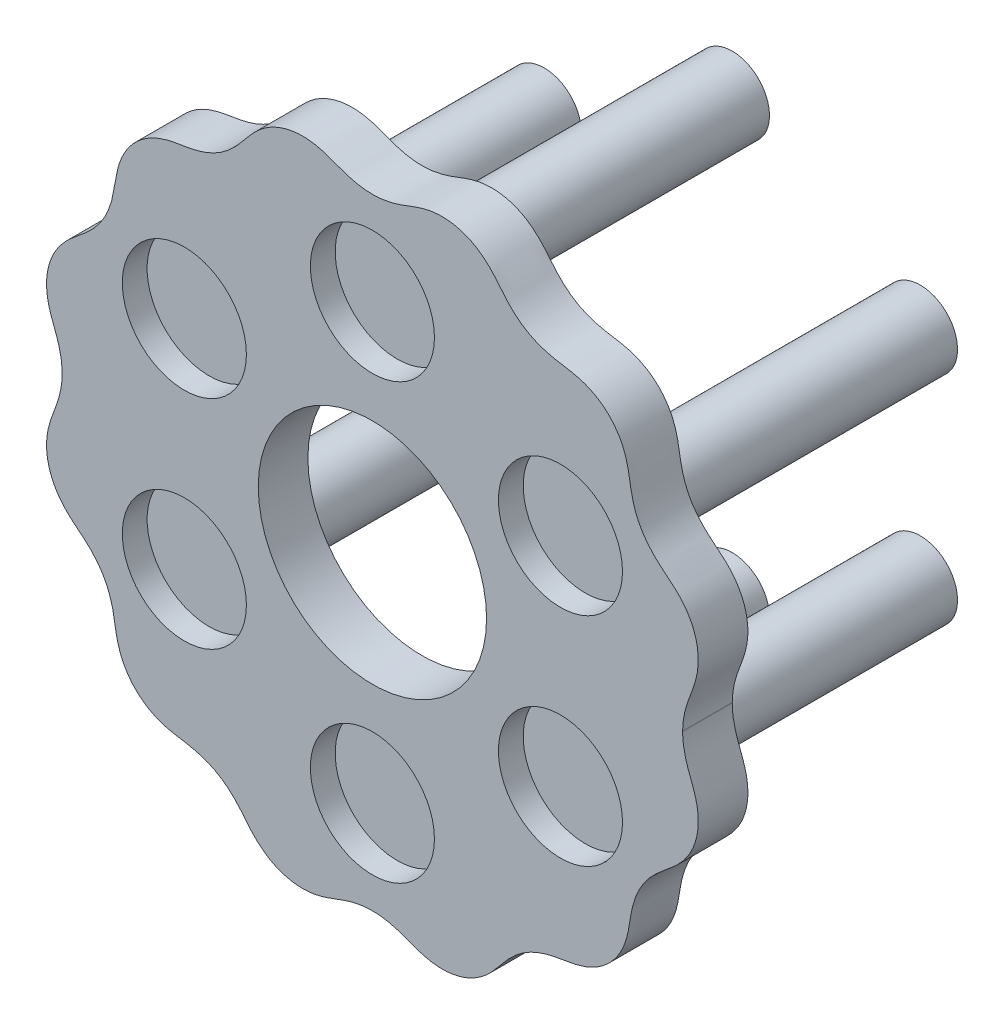
from build123d import *

# Parameters (mm, degrees)
SKETCH3_R           = 9.2
BOSS_EXTRUDE2_DEPTH = 4
SKETCH7_R           = 3
BOSS_EXTRUDE3_DEPTH = 25
SKETCH6_R           = 5
CUT_EXTRUDE2_DEPTH  = 2


with BuildPart() as part:
    # Sketch3 → Boss-Extrude2 (new body)
    with BuildSketch(Plane.XY):
        with BuildLine():
            add(Edge.make_bspline(
                [(25, 0), (25, -0.028419379), (25.000492821, -0.085240091), (25.002710517, -0.186096381), (25.008616202, -0.331732724), (25.017454216, -0.471095426), (25.029199756, -0.604110594), (25.043819456, -0.735775062), (25.0612711, -0.868216065), (25.086561311, -1.034185241), (25.122348392, -1.232409452), (25.171720804, -1.461619521), (25.23785416, -1.72161835), (25.33146082, -2.043525868), (25.437671669, -2.361532194), (25.552791346, -2.676356937), (25.69530689, -3.052450734), (25.837320412, -3.428807717), (26.007461604, -3.919608843), (26.169082038, -4.536352918), (26.29301302, -5.400577617), (26.248865742, -6.509268079), (25.900590468, -7.758927573), (25.250933039, -8.824024045), (24.559448754, -9.548775191), (23.872924134, -10.132867754), (23.242034799, -10.633504856), (22.540451444, -11.262027255), (21.859772382, -12.093532725), (21.337087227, -13.027141562), (20.986474338, -14.032216693), (20.783152218, -15.069054613), (20.629229677, -16.210615672), (20.295790024, -17.423577203), (19.620081418, -18.614367157), (18.57817853, -19.648167397), (17.377311503, -20.316253266), (16.151486918, -20.639994045), (14.739949908, -20.826544524), (13.439402762, -21.1258531), (12.23711891, -21.731124361), (11.217263285, -22.586282659), (10.510510486, -23.382376891), (9.803864636, -24.301158332), (8.912502074, -25.202295013), (7.731407454, -25.911659846), (6.309337856, -26.299864083), (4.931582798, -26.288472232), (3.706115601, -25.964583322), (2.633674004, -25.522967435), (1.62667227, -25.181750578), (0.581426656, -24.989102643), (-0.478930933, -24.980713481), (-1.520966388, -25.154635937), (-2.520449471, -25.479461333), (-3.419229104, -25.84785235), (-4.274357012, -26.11935553), (-5.084141891, -26.255225085), (-5.827195666, -26.277840049), (-6.751118437, -26.176673588), (-7.819413481, -25.850368791), (-8.864535557, -25.241992085), (-9.774472842, -24.337578456), (-10.489042176, -23.409443312), (-11.198070814, -22.604475083), (-12.019349647, -21.910802096), (-12.950687048, -21.371323607), (-13.961150534, -21.004447957), (-15.012542859, -20.790681073), (-16.17349347, -20.636604415), (-17.412795128, -20.30409628), (-18.621589199, -19.617234196), (-19.535225069, -18.69087907), (-20.109505434, -17.744490957), (-20.468260184, -16.811352879), (-20.669325741, -15.929542243), (-20.800368009, -14.951283195), (-21.021499046, -13.897450049), (-21.399469544, -12.891789727), (-21.945671579, -11.971536034), (-22.639598338, -11.164500934), (-23.435367487, -10.469229858), (-24.347111984, -9.765350187), (-25.232158972, -8.871517572), (-25.925709908, -7.694669196), (-26.301679816, -6.282910402), (-26.285367064, -4.916976266), (-25.96232166, -3.701401982), (-25.524214021, -2.636206013), (-25.184526072, -1.63546138), (-24.98964456, -0.589100982), (-24.979676648, 0.481005828), (-25.157831343, 1.540454587), (-25.495205931, 2.562927815), (-25.870736407, 3.4757204), (-26.135455064, 4.34059116), (-26.288515222, 5.328583568), (-26.261093111, 6.43001327), (-25.933564455, 7.678441647), (-25.237701394, 8.866637346), (-24.34504384, 9.767557339), (-23.427022399, 10.47557852), (-22.62699323, 11.1763696), (-21.936896568, 11.984292454), (-21.397747575, 12.897748952), (-21.026718925, 13.886522177), (-20.806135146, 14.914602211), (-20.653045268, 16.060286336), (-20.395622874, 17.11611043), (-19.95690194, 18.028441349), (-19.300149626, 18.928757994), (-18.483671803, 19.692277913), (-17.435839429, 20.294614033), (-16.197622229, 20.632400397), (-15.036829757, 20.787344769), (-13.984887122, 20.997904882), (-12.973147938, 21.361026229), (-12.039474616, 21.896555136), (-11.215678135, 22.58716662), (-10.504008287, 23.390162439), (-9.790282182, 24.318640694), (-8.884052218, 25.226941722), (-7.685868846, 25.932204762), (-6.427337904, 26.262197332), (-5.32062142, 26.288060185), (-4.332905845, 26.133623194), (-3.468339345, 25.867884001), (-2.55560208, 25.492296977), (-1.532755887, 25.155882506), (-0.473083435, 24.979033961), (0.597006536, 24.990441303), (1.643127458, 25.186582226), (2.643510183, 25.527172752), (3.708827205, 25.965063812), (4.924909383, 26.286396603), (6.29085556, 26.300692327), (7.702048601, 25.922603812), (8.877880267, 25.227310889), (9.770417048, 24.341030317), (10.474070774, 23.429151565), (11.170105737, 22.633979321), (11.977973527, 21.941022037), (12.898969216, 21.396054985), (13.905080963, 21.019330701), (14.959093015, 20.79921578), (15.93734026, 20.668117182), (16.818953838, 20.466007301), (17.751576334, 20.105941467), (18.697120313, 19.53023506), (19.622089623, 18.615234931), (20.307180817, 17.405403853), (20.637904711, 16.165690953), (20.791787115, 15.004742729), (21.00656033, 13.953487), (21.374668771, 12.943487437), (21.915401419, 12.012841988), (22.610070929, 11.192473379), (23.415648604, 10.48411951), (24.343684699, 9.769551905), (25.246796647, 8.857951736), (25.940942688, 7.662077141), (26.262511444, 6.413848041), (26.28479299, 5.412288327), (26.191439435, 4.704296235), (26.088108997, 4.226630913), (25.967232391, 3.802316147), (25.80790495, 3.345695262), (25.619629464, 2.855327013), (25.458833672, 2.424502992), (25.333860765, 2.050706314), (25.241721849, 1.735435761), (25.176361339, 1.480873774), (25.120257899, 1.224415288), (25.074119122, 0.965148365), (25.038505918, 0.70465122), (25.016960864, 0.482504301), (25.005267885, 0.264321243), (25.00135895, 0.133217809), (25.000430803, 0.077544036), (25.000203175, 0.049701947)],
                knots=[0.076056741, 0.076056741, 0.076056741, 0.076056741, 0.076056741, 0.076716626, 0.077376511, 0.078036395, 0.07869628, 0.079356165, 0.080016049, 0.080675934, 0.081335819, 0.082655588, 0.083975357, 0.085295127, 0.086614896, 0.089254435, 0.090574204, 0.091893973, 0.094533512, 0.097173051, 0.100798473, 0.104423896, 0.11167474, 0.118848356, 0.126021971, 0.128665019, 0.131308067, 0.136594162, 0.141880258, 0.147166354, 0.152357566, 0.157548778, 0.16273999, 0.167931202, 0.175042017, 0.182152833, 0.189326507, 0.196500181, 0.201723091, 0.206946, 0.217391818, 0.222614771, 0.227837725, 0.233060678, 0.238283631, 0.245457287, 0.252630943, 0.259804707, 0.266978471, 0.272201179, 0.277423888, 0.282646597, 0.287869306, 0.293029544, 0.298189783, 0.303350022, 0.308510261, 0.312159961, 0.315809662, 0.319459363, 0.323109064, 0.330383447, 0.337657831, 0.342925117, 0.348192403, 0.353459689, 0.358726976, 0.363994339, 0.369261702, 0.374529065, 0.379796429, 0.387070764, 0.394345099, 0.401518721, 0.405105533, 0.408692344, 0.413978427, 0.419264509, 0.424550592, 0.429836675, 0.435027902, 0.440219129, 0.445410356, 0.450601583, 0.457712386, 0.464823188, 0.471933966, 0.479044743, 0.484236012, 0.489427281, 0.49461855, 0.499809819, 0.505095864, 0.510381909, 0.515667954, 0.520953999, 0.524540818, 0.528127637, 0.535301275, 0.542475056, 0.549648837, 0.554871514, 0.56009419, 0.565316866, 0.570539542, 0.575699809, 0.580860077, 0.586020345, 0.591180612, 0.598480006, 0.602129703, 0.605779399, 0.613053806, 0.620328213, 0.625595461, 0.630862709, 0.636129958, 0.641397206, 0.646664608, 0.651932009, 0.65719941, 0.662466812, 0.669741122, 0.677015431, 0.684189061, 0.687775877, 0.691362692, 0.696648757, 0.701934822, 0.707220888, 0.712506953, 0.7176982, 0.722889446, 0.728080693, 0.73327194, 0.740382729, 0.747493519, 0.754604309, 0.761715099, 0.766906345, 0.772097591, 0.777288837, 0.782480083, 0.787766149, 0.793052215, 0.798338281, 0.803624347, 0.807211162, 0.810797977, 0.817971607, 0.825245917, 0.832520228, 0.837787628, 0.843055028, 0.848322428, 0.853589828, 0.858857078, 0.864124328, 0.869391577, 0.874658827, 0.881933233, 0.889207639, 0.896231602, 0.899743584, 0.901499575, 0.903255566, 0.905841573, 0.908427581, 0.911013588, 0.913599595, 0.914892599, 0.916185603, 0.917478607, 0.91877161, 0.920064614, 0.921357618, 0.922650621, 0.923297123, 0.923943625, 0.923943625, 0.923943625, 0.923943625, 0.923943625], degree=4))
            Line((25.000203175, 0.049701947), (25, 0))
        make_face()
        Circle(SKETCH3_R, mode=Mode.SUBTRACT)
    extrude(amount=BOSS_EXTRUDE2_DEPTH)

    # Sketch7 → Boss-Extrude3 (add)
    with BuildSketch(Plane(origin=(0, 0, 0), x_dir=(-1, 0, 0), z_dir=(0, 0, -1))):
        with Locations((0, 17.5)):
            Circle(SKETCH7_R)
        with Locations((15.155444566, 8.75)):
            Circle(SKETCH7_R)
        with Locations((15.155444566, -8.75)):
            Circle(SKETCH7_R)
        with Locations((0, -17.5)):
            Circle(SKETCH7_R)
        with Locations((-15.155444566, -8.75)):
            Circle(SKETCH7_R)
        with Locations((-15.155444566, 8.75)):
            Circle(SKETCH7_R)
    extrude(amount=BOSS_EXTRUDE3_DEPTH)

    # Sketch6 → Cut-Extrude2 (cut)
    with BuildSketch(Plane.XY.offset(4)):
        with Locations((15.155444566, -8.75)):
            Circle(SKETCH6_R)
        with Locations((0, -17.5)):
            Circle(SKETCH6_R)
        with Locations((-15.155444566, -8.75)):
            Circle(SKETCH6_R)
        with Locations((15.155444566, 8.75)):
            Circle(SKETCH6_R)
        with Locations((0, 17.5)):
            Circle(SKETCH6_R)
        with Locations((-15.155444566, 8.75)):
            Circle(SKETCH6_R)
    extrude(amount=-CUT_EXTRUDE2_DEPTH, mode=Mode.SUBTRACT)


solid = part.part
